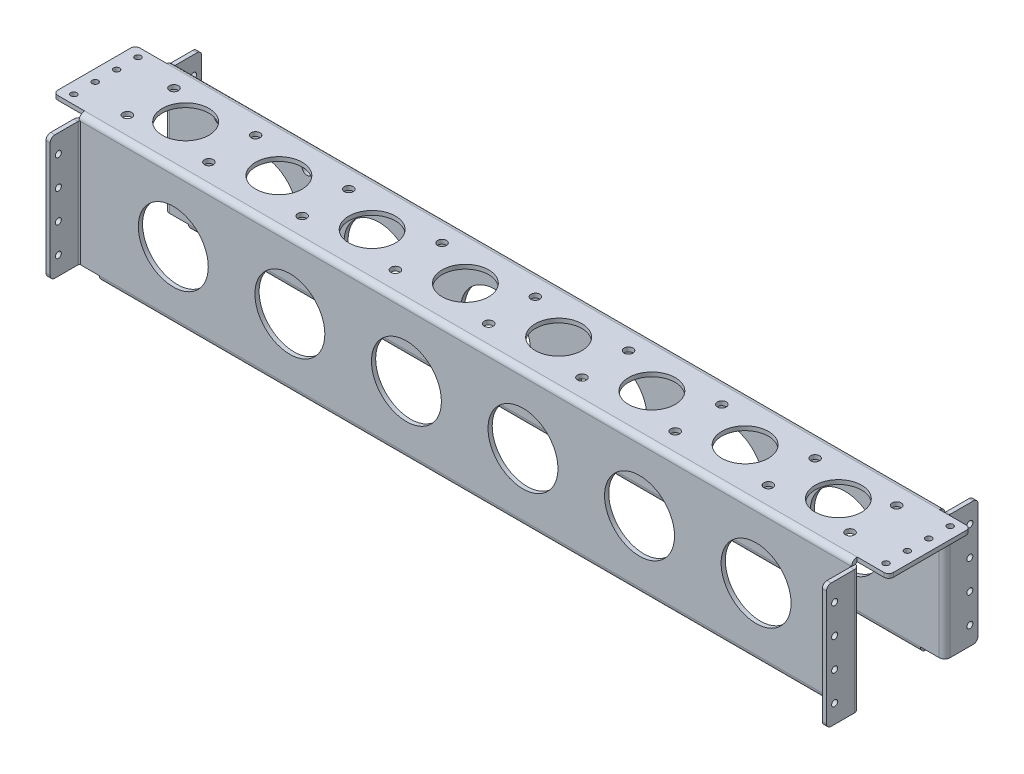
from build123d import *

# Parameters (mm, degrees)
BASE_FLANGE2_DEPTH           = 210.439
SKETCH12_W                   = 11.049
SKETCH12_H                   = 3.0226
CUT_EXTRUDE1_DEPTH           = 232.127971322
SKETCH14_W                   = 17.145
SKETCH14_H                   = 44.7548
BOSS_EXTRUDE1_DEPTH          = 2.286
EDGE_FLANGE1_STRIP_W         = 10.7442
EDGE_FLANGE1_STRIP_H         = 2.286
EDGE_FLANGE1_STRIP_CUT_DEPTH = 67.6783
EDGE_FLANGE1_DEPTH           = 67.6783
MIRROR6_COPY_1_SKETCH_W      = 10.7442
MIRROR6_COPY_1_SKETCH_H      = 2.286
MIRROR6_COPY_1_DEPTH         = 67.6783
MIRROR6_COPY_2_DEPTH         = 67.6783
SKETCH19_R                   = 1.6383
CUT_EXTRUDE3_DEPTH           = 243.761729136
SKETCH20_R                   = 1.6383
CUT_EXTRUDE4_DEPTH           = 448.847223007
SKETCH21_R                   = 12.7
CUT_EXTRUDE5_DEPTH           = 2.54
SKETCH22_R                   = 19.05
CUT_EXTRUDE6_DEPTH           = 248.675895249
SKETCH23_R                   = 1.6256
CUT_EXTRUDE7_DEPTH           = 243.077299818
FILLET1_R                    = 2.54
FILLET2_R                    = 2.54
SKETCH25_R                   = 2.4257
CUT_EXTRUDE9_DEPTH           = 2.286
SKETCH26_R                   = 2.4257
CUT_EXTRUDE10_DEPTH          = 2.54
F_6_CLEARANCE_HOLE1_D        = 5.159375
F_6_CLEARANCE_HOLE1_DEPTH    = 2.286


# Sheet-metal steps are written as plain solids
with BuildPart() as part:
    # cross section → Base-Flange2 (new, symmetric)
    with BuildSketch(Plane(origin=(0, 0, 0), x_dir=(0, 0, -1), z_dir=(1, 0, 0))):
        with BuildLine():
            Line((-12.7, -2.286), (-22.3774, -2.286))
            ThreePointArc((-22.3774, -2.286), (-24.514700957, -1.400700957), (-25.4, 0.7366))
            Line((-25.4, 0.7366), (-25.4, 68.4149))
            ThreePointArc((-25.4, 68.4149), (-24.514700957, 70.552200957), (-22.3774, 71.4375))
            Line((-22.3774, 71.4375), (22.3774, 71.4375))
            ThreePointArc((22.3774, 71.4375), (24.514700957, 70.552200957), (25.4, 68.4149))
            Line((25.4, 68.4149), (25.4, 0.7366))
            ThreePointArc((25.4, 0.7366), (25.615745145, 0.215745145), (26.1366, 0))
            Line((26.1366, 0), (38.1, 0))
            Line((38.1, 0), (38.1, -2.286))
            Line((38.1, -2.286), (26.1366, -2.286))
            ThreePointArc((26.1366, -2.286), (23.999299043, -1.400700957), (23.114, 0.7366))
            Line((23.114, 0.7366), (23.114, 68.4149))
            ThreePointArc((23.114, 68.4149), (22.898254855, 68.935754855), (22.3774, 69.1515))
            Line((22.3774, 69.1515), (-22.3774, 69.1515))
            ThreePointArc((-22.3774, 69.1515), (-22.898254855, 68.935754855), (-23.114, 68.4149))
            Line((-23.114, 68.4149), (-23.114, 0.7366))
            ThreePointArc((-23.114, 0.7366), (-22.898254855, 0.215745145), (-22.3774, 0))
            Line((-22.3774, 0), (-12.7, 0))
            Line((-12.7, 0), (-12.7, -2.286))
        make_face()
    extrude(amount=BASE_FLANGE2_DEPTH, both=True)

    # Sketch12 → Cut-Extrude1 (cut, through all)
    with BuildSketch(Plane(origin=(0, 0, -38.1), x_dir=(-1, 0, 0), z_dir=(0, 0, -1))):
        with Locations((-204.9145, -0.7747)):
            Rectangle(SKETCH12_W, SKETCH12_H)
    cut_extrude1 = extrude(amount=-CUT_EXTRUDE1_DEPTH, mode=Mode.SUBTRACT)

    # Sketch14 → Boss-Extrude1 (add)
    with BuildSketch(Plane(origin=(0, 71.4375, 0), x_dir=(1, 0, 0), z_dir=(0, 1, 0))):
        with Locations((219.0115, 0)):
            Rectangle(SKETCH14_W, SKETCH14_H)
    boss_extrude1 = extrude(amount=-BOSS_EXTRUDE1_DEPTH)

    # Mirror4: Cut-Extrude1, Boss-Extrude1 across plane
    add(cut_extrude1.mirror(Plane(origin=(0, 0, 0), x_dir=(0, 0, 1), z_dir=(1, 0, 0))), mode=Mode.SUBTRACT)
    add(boss_extrude1.mirror(Plane(origin=(0, 0, 0), x_dir=(0, 0, 1), z_dir=(1, 0, 0))))

    # Edge-Flange1 strip (across the edge) → Edge-Flange1 strip cut (cut)
    with BuildSketch(Plane(origin=(210.312, 0.7366, 25.4), x_dir=(-1, 0, 0), z_dir=(0, 1, 0))):
        with Locations((-4.6355, -1.143)):
            Rectangle(EDGE_FLANGE1_STRIP_W, EDGE_FLANGE1_STRIP_H)
    edge_flange1_strip_cut = extrude(amount=EDGE_FLANGE1_STRIP_CUT_DEPTH, mode=Mode.SUBTRACT)

    # Edge-Flange1 section (across the edge) → Edge-Flange1 (add)
    with BuildSketch(Plane(origin=(210.312, 0.7366, 25.4), x_dir=(-1, 0, 0), z_dir=(0, 1, 0))):
        with BuildLine():
            Line((-2.286, 0.7366), (-2.286, 15.875))
            Line((-2.286, 15.875), (0, 15.875))
            Line((0, 15.875), (0, 0.7366))
            ThreePointArc((0, 0.7366), (0.215745145, 0.215745145), (0.7366, 0))
            Line((0.7366, 0), (0.7366, -2.286))
            ThreePointArc((0.7366, -2.286), (-1.400700957, -1.400700957), (-2.286, 0.7366))
        make_face()
    edge_flange1 = extrude(amount=EDGE_FLANGE1_DEPTH)

    # Mirror5: Edge-Flange1 strip cut, Edge-Flange1 across plane
    add(edge_flange1_strip_cut.mirror(Plane(origin=(0, 0, 0), x_dir=(0, 0, 1), z_dir=(1, 0, 0))), mode=Mode.SUBTRACT)
    add(edge_flange1.mirror(Plane(origin=(0, 0, 0), x_dir=(0, 0, 1), z_dir=(1, 0, 0))))

    # Mirror6: Edge-Flange1 strip cut, Edge-Flange1 across plane
    add(edge_flange1_strip_cut.mirror(Plane.XY), mode=Mode.SUBTRACT)
    add(edge_flange1.mirror(Plane.XY))

    # Mirror6 copy 1 sketch → Mirror6 copy 1 (cut)
    with BuildSketch(Plane(origin=(-210.312, 0.7366, -25.4), x_dir=(1, 0, 0), z_dir=(0, 1, 0))):
        with Locations((-4.6355, -1.143)):
            Rectangle(MIRROR6_COPY_1_SKETCH_W, MIRROR6_COPY_1_SKETCH_H)
    extrude(amount=MIRROR6_COPY_1_DEPTH, mode=Mode.SUBTRACT)

    # Mirror6 copy 2 sketch → Mirror6 copy 2 (add)
    with BuildSketch(Plane(origin=(-210.312, 0.7366, -25.4), x_dir=(1, 0, 0), z_dir=(0, 1, 0))):
        with BuildLine():
            Line((-2.286, 0.7366), (-2.286, 15.875))
            Line((-2.286, 15.875), (0, 15.875))
            Line((0, 15.875), (0, 0.7366))
            ThreePointArc((0, 0.7366), (0.215745145, 0.215745145), (0.7366, 0))
            Line((0.7366, 0), (0.7366, -2.286))
            ThreePointArc((0.7366, -2.286), (-1.400700957, -1.400700957), (-2.286, 0.7366))
        make_face()
    extrude(amount=MIRROR6_COPY_2_DEPTH)

    # Sketch19 → Cut-Extrude3 (cut, through all)
    with BuildSketch(Plane(origin=(0, 71.4375, 0), x_dir=(1, 0, 0), z_dir=(0, 1, 0))):
        with Locations(Location((-221.234, 17.4625, 0), (0, 0, 270))):
            Circle(SKETCH19_R)
        with Locations(Location((-221.234, -17.4625, 0), (0, 0, 270))):
            Circle(SKETCH19_R)
        with Locations(Location((221.234, -17.4625, 0), (0, 0, 90))):
            Circle(SKETCH19_R)
        with Locations(Location((221.234, 17.4625, 0), (0, 0, 90))):
            Circle(SKETCH19_R)
        with Locations(Location((-221.234, -5.820833333, 0), (0, 0, 270))):
            Circle(SKETCH19_R)
        with Locations(Location((-221.234, 5.820833333, 0), (0, 0, 270))):
            Circle(SKETCH19_R)
        with Locations(Location((221.234, -5.820833333, 0), (0, 0, 270))):
            Circle(SKETCH19_R)
        with Locations(Location((221.234, 5.820833333, 0), (0, 0, 270))):
            Circle(SKETCH19_R)
    extrude(amount=-CUT_EXTRUDE3_DEPTH, mode=Mode.SUBTRACT)

    # Sketch20 → Cut-Extrude4 (cut, through all)
    with BuildSketch(Plane(origin=(212.598, 0, 0), x_dir=(0, 0, -1), z_dir=(1, 0, 0))):
        with Locations((-36.83, 58.38825)):
            Circle(SKETCH20_R)
        with Locations((-36.83, 42.51325)):
            Circle(SKETCH20_R)
        with Locations((-36.83, 26.63825)):
            Circle(SKETCH20_R)
        with Locations((-36.83, 10.76325)):
            Circle(SKETCH20_R)
        with Locations((36.83, 10.76325)):
            Circle(SKETCH20_R)
        with Locations((36.83, 26.63825)):
            Circle(SKETCH20_R)
        with Locations((36.83, 42.51325)):
            Circle(SKETCH20_R)
        with Locations((36.83, 58.38825)):
            Circle(SKETCH20_R)
    extrude(amount=-CUT_EXTRUDE4_DEPTH, mode=Mode.SUBTRACT)

    # Sketch21 → Cut-Extrude5 (cut)
    with BuildSketch(Plane(origin=(0, 71.4375, 0), x_dir=(1, 0, 0), z_dir=(0, 1, 0))):
        with Locations(Location((177.8, 0, 0), (0, 0, 270))):
            Circle(SKETCH21_R)
        with Locations(Location((127, 0, 0), (0, 0, 270))):
            Circle(SKETCH21_R)
        with Locations(Location((76.2, 0, 0), (0, 0, 270))):
            Circle(SKETCH21_R)
        with Locations(Location((25.4, 0, 0), (0, 0, 270))):
            Circle(SKETCH21_R)
        with Locations(Location((-25.4, 0, 0), (0, 0, 270))):
            Circle(SKETCH21_R)
        with Locations(Location((-76.2, 0, 0), (0, 0, 270))):
            Circle(SKETCH21_R)
        with Locations(Location((-127, 0, 0), (0, 0, 270))):
            Circle(SKETCH21_R)
        with Locations(Location((-177.8, 0, 0), (0, 0, 270))):
            Circle(SKETCH21_R)
    extrude(amount=-CUT_EXTRUDE5_DEPTH, mode=Mode.SUBTRACT)

    # Sketch22 → Cut-Extrude6 (cut, through all)
    with BuildSketch(Plane.XY.offset(25.4)):
        with Locations((-159.1183, 34.57575)):
            Circle(SKETCH22_R)
        with Locations((-95.6183, 34.57575)):
            Circle(SKETCH22_R)
        with Locations((-32.1183, 34.57575)):
            Circle(SKETCH22_R)
        with Locations((31.3817, 34.57575)):
            Circle(SKETCH22_R)
        with Locations((94.8817, 34.57575)):
            Circle(SKETCH22_R)
        with Locations((158.3817, 34.57575)):
            Circle(SKETCH22_R)
    extrude(amount=-CUT_EXTRUDE6_DEPTH, mode=Mode.SUBTRACT)

    # Sketch23 → Cut-Extrude7 (cut, through all)
    with BuildSketch(Plane(origin=(0, 0, 0), x_dir=(1, 0, 0), z_dir=(0, 1, 0))):
        with Locations(Location((-190.5, 32.1564, 0), (0, 0, 270))):
            Circle(SKETCH23_R)
        with Locations(Location((-148.166666667, 32.1564, 0), (0, 0, 270))):
            Circle(SKETCH23_R)
        with Locations(Location((-105.833333333, 32.1564, 0), (0, 0, 270))):
            Circle(SKETCH23_R)
        with Locations(Location((-63.5, 32.1564, 0), (0, 0, 270))):
            Circle(SKETCH23_R)
        with Locations(Location((-21.166666667, 32.1564, 0), (0, 0, 270))):
            Circle(SKETCH23_R)
        with Locations(Location((21.166666667, 32.1564, 0), (0, 0, 270))):
            Circle(SKETCH23_R)
        with Locations(Location((63.5, 32.1564, 0), (0, 0, 270))):
            Circle(SKETCH23_R)
        with Locations(Location((105.833333333, 32.1564, 0), (0, 0, 270))):
            Circle(SKETCH23_R)
        with Locations(Location((148.166666667, 32.1564, 0), (0, 0, 270))):
            Circle(SKETCH23_R)
        with Locations(Location((190.5, 32.1564, 0), (0, 0, 270))):
            Circle(SKETCH23_R)
        with Locations(Location((190.5, -17.5006, 0), (0, 0, 90))):
            Circle(SKETCH23_R)
        with Locations(Location((148.166666667, -17.5006, 0), (0, 0, 90))):
            Circle(SKETCH23_R)
        with Locations(Location((105.833333333, -17.5006, 0), (0, 0, 90))):
            Circle(SKETCH23_R)
        with Locations(Location((63.5, -17.5006, 0), (0, 0, 90))):
            Circle(SKETCH23_R)
        with Locations(Location((21.166666667, -17.5006, 0), (0, 0, 90))):
            Circle(SKETCH23_R)
        with Locations(Location((-21.166666667, -17.5006, 0), (0, 0, 90))):
            Circle(SKETCH23_R)
        with Locations(Location((-63.5, -17.5006, 0), (0, 0, 90))):
            Circle(SKETCH23_R)
        with Locations(Location((-105.833333333, -17.5006, 0), (0, 0, 90))):
            Circle(SKETCH23_R)
        with Locations(Location((-148.166666667, -17.5006, 0), (0, 0, 90))):
            Circle(SKETCH23_R)
        with Locations(Location((-190.5, -17.5006, 0), (0, 0, 90))):
            Circle(SKETCH23_R)
    extrude(amount=-CUT_EXTRUDE7_DEPTH, mode=Mode.SUBTRACT)

    # Fillet1
    fillet1_edges = [part.edges().sort_by_distance(p)[0] for p in [
        (227.584, 70.2945, 22.3774),
        (227.584, 70.2945, -22.3774),
        (-227.584, 70.2945, 22.3774),
        (-227.584, 70.2945, -22.3774),
    ]]
    fillet(fillet1_edges, radius=FILLET1_R)

    # Fillet2
    fillet2_edges = [part.edges().sort_by_distance(p)[0] for p in [
        (211.455, 0.7366, 41.275),
        (211.455, 68.4149, 41.275),
        (-211.455, 68.4149, 41.275),
        (-211.455, 0.7366, 41.275),
        (211.455, 68.4149, -41.275),
        (211.455, 0.7366, -41.275),
        (-211.455, 0.7366, -41.275),
        (-211.455, 68.4149, -41.275),
    ]]
    fillet(fillet2_edges, radius=FILLET2_R)

    # Sketch25 → Cut-Extrude9 (cut)
    with BuildSketch(Plane(origin=(0, 71.4375, 0), x_dir=(1, 0, 0), z_dir=(0, 1, 0))):
        with Locations(Location((-152.4, 12.7, 0), (0, 0, 270))):
            Circle(SKETCH25_R)
        with Locations(Location((-152.4, -12.7, 0), (0, 0, 270))):
            Circle(SKETCH25_R)
        with Locations(Location((-101.6, 12.7, 0), (0, 0, 270))):
            Circle(SKETCH25_R)
        with Locations(Location((-101.6, -12.7, 0), (0, 0, 270))):
            Circle(SKETCH25_R)
        with Locations(Location((-50.8, 12.7, 0), (0, 0, 270))):
            Circle(SKETCH25_R)
        with Locations(Location((-50.8, -12.7, 0), (0, 0, 270))):
            Circle(SKETCH25_R)
        with Locations(Location((0, 12.7, 0), (0, 0, 270))):
            Circle(SKETCH25_R)
        with Locations(Location((0, -12.7, 0), (0, 0, 270))):
            Circle(SKETCH25_R)
        with Locations(Location((50.8, 12.7, 0), (0, 0, 270))):
            Circle(SKETCH25_R)
        with Locations(Location((50.8, -12.7, 0), (0, 0, 270))):
            Circle(SKETCH25_R)
        with Locations(Location((101.6, 12.7, 0), (0, 0, 270))):
            Circle(SKETCH25_R)
        with Locations(Location((101.6, -12.7, 0), (0, 0, 270))):
            Circle(SKETCH25_R)
        with Locations(Location((152.4, 12.7, 0), (0, 0, 270))):
            Circle(SKETCH25_R)
        with Locations(Location((152.4, -12.7, 0), (0, 0, 270))):
            Circle(SKETCH25_R)
    extrude(amount=-CUT_EXTRUDE9_DEPTH, mode=Mode.SUBTRACT)

    # Sketch26 → Cut-Extrude10 (cut)
    with BuildSketch(Plane(origin=(0, 71.4375, 0), x_dir=(1, 0, 0), z_dir=(0, 1, 0))):
        with Locations(Location((196.85, 12.7, 0), (0, 0, 270))):
            Circle(SKETCH26_R)
        with Locations(Location((196.85, -12.7, 0), (0, 0, 270))):
            Circle(SKETCH26_R)
        with Locations(Location((-196.85, -12.7, 0), (0, 0, 270))):
            Circle(SKETCH26_R)
        with Locations(Location((-196.85, 12.7, 0), (0, 0, 270))):
            Circle(SKETCH26_R)
    extrude(amount=-CUT_EXTRUDE10_DEPTH, mode=Mode.SUBTRACT)

    # #6 Clearance Hole1
    with Locations(Plane(origin=(0, 0, -25.4), x_dir=(-1, 0, 0), z_dir=(0, 0, -1))):
        with Locations((45.6819, 61.0616), (106.7181, 61.0616), (134.874, 58.714), (182.626, 58.714), (182.626, 15.661), (134.874, 15.661), (106.7181, 12.2174), (45.6819, 12.2174)):
            Hole(F_6_CLEARANCE_HOLE1_D / 2, depth=F_6_CLEARANCE_HOLE1_DEPTH)


solid = part.part
